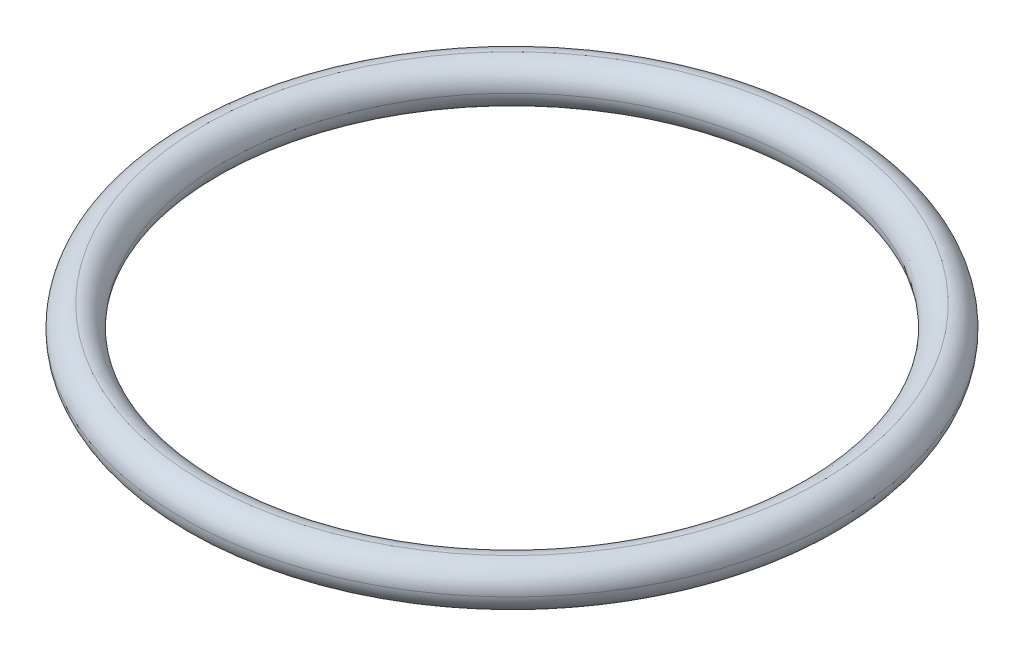
from build123d import *

# Parameters (mm, degrees)
SKETCH_2_R      = 23.5
SKETCH_2_R_2    = 20.5
EXTRUDE_1_DEPTH = 3
FILLET_2_R      = 1.5


with BuildPart() as part:
    # 草图2 → 凸台-拉伸1 (new body)
    with BuildSketch(Plane(origin=(0, 0, 0), x_dir=(1, 0, 0), z_dir=(0, 1, 0))):
        with Locations(Location((0, 0, 0), (0, 0, 270))):
            Circle(SKETCH_2_R)
        with Locations(Location((0, 0, 0), (0, 0, 270))):
            Circle(SKETCH_2_R_2, mode=Mode.SUBTRACT)
    extrude(amount=EXTRUDE_1_DEPTH)

    # 圆角2
    fillet_2_edges = [part.edges().sort_by_distance(p)[0] for p in [
        (0, 0, -23.5),
        (0, 3, -23.5),
        (0, 0, -20.5),
        (0, 3, -20.5),
    ]]
    fillet(fillet_2_edges, radius=FILLET_2_R - 0.0001)  # a hair under: the kernel refuses the full size


solid = part.part
